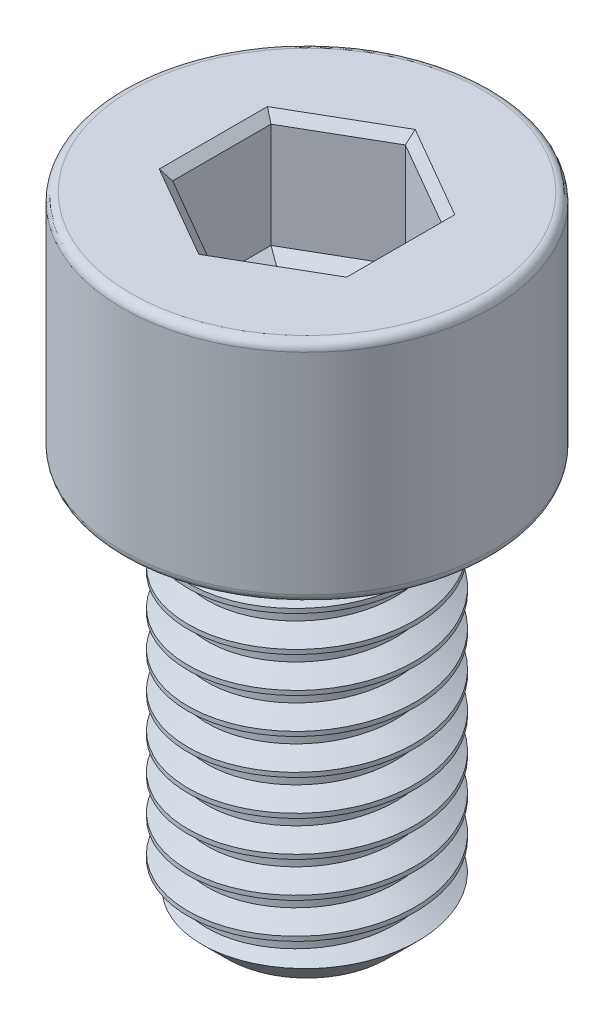
from build123d import *

# Parameters (mm, degrees)
SKETCH1_R           = 4
BOSS_EXTRUDE1_DEPTH = 14
THREAD1_PITCH       = 1.25
SKETCH2_R           = 6.5
BOSS_EXTRUDE2_DEPTH = 8
FILLET1_R           = 0.3
CUT_EXTRUDE1_DEPTH  = 4
CHAMFER1_SIZE       = 0.3
CUT_EXTRUDE2_DEPTH  = 0.4
CUT_EXTRUDE2_DRAFT  = -60


with BuildPart() as part:
    # Sketch1 → Boss-Extrude1 (new body)
    with BuildSketch(Plane(origin=(0, 0, 0), x_dir=(1, 0, 0), z_dir=(0, 1, 0))):
        with Locations(Location((0, 0, 0), (0, 0, 270))):
            Circle(SKETCH1_R)
    extrude(amount=BOSS_EXTRUDE1_DEPTH)

    # Thread1: the profile of Thread Profile1 profile screwed along a right-hand helix of 12.2 turns, 8 arcs to a turn; built about Z, then put on its axis
    thread1_z = Axis((0, 0, 0), (0, 0, 1))
    thread1_corners = [(4.0003, 0, -0.000173205), (4.0003, 0, 1.093923202), (3.323417656, 0, 0.703124998), (3.323417656, 0, 0.390624998)]
    with BuildLine(mode=Mode.PRIVATE) as thread1_profile:
        Line(thread1_corners[0], thread1_corners[1])
        Line(thread1_corners[1], thread1_corners[2])
        Line(thread1_corners[2], thread1_corners[3])
        Line(thread1_corners[3], thread1_corners[0])
    thread1_cap = Face(thread1_profile.wire())
    thread1_turn_angles = [0, 22.5, 45, 67.5, 90, 112.5, 135, 157.5, 180, 202.5, 225, 247.5, 270, 292.5, 315, 337.5, 360]
    thread1_turn_weights = [1, 0.9238795325112867, 1, 0.9238795325112867, 1, 0.9238795325112867, 1, 0.9238795325112867, 1, 0.9238795325112867, 1, 0.9238795325112867, 1, 0.9238795325112867, 1, 0.9238795325112867, 1]
    thread1_turn_rails = [Edge.make_bspline([Vector(p[0], p[1], 0).rotate(thread1_z, thread1_turn_angles[k]) / thread1_turn_weights[k] + Vector(0, 0, p[2] + THREAD1_PITCH * thread1_turn_angles[k] / 360) for k in range(17)], [0, 0, 0, 1, 1, 2, 2, 3, 3, 4, 4, 5, 5, 6, 6, 7, 7, 8, 8, 8], 2, thread1_turn_weights) for p in thread1_corners]
    thread1_turn_sides = [Face.make_surface_from_curves(thread1_turn_rails[p[0]], thread1_turn_rails[p[1]]) for p in [(0, 1), (1, 2), (2, 3), (3, 0)]]
    thread1_last_angles = [4320, 4342.5, 4365, 4378.5, 4392]
    thread1_last_weights = [1, 0.9238795325112867, 1, 0.9723699203976766, 1]
    thread1_last_rails = [Edge.make_bspline([Vector(p[0], p[1], 0).rotate(thread1_z, thread1_last_angles[k]) / thread1_last_weights[k] + Vector(0, 0, p[2] + THREAD1_PITCH * thread1_last_angles[k] / 360) for k in range(5)], [0, 0, 0, 1, 1, 2, 2, 2], 2, thread1_last_weights) for p in thread1_corners]
    thread1_last_sides = [Face.make_surface_from_curves(thread1_last_rails[p[0]], thread1_last_rails[p[1]]) for p in [(0, 1), (1, 2), (2, 3), (3, 0)]]
    thread1 = Plane(origin=(0, 15.25, 0), x_dir=(-1, 0, 0), z_dir=(0, -1, 0)) * Solid(Shell([*[p.moved(Location((0, 0, THREAD1_PITCH * i))) for i in range(12) for p in thread1_turn_sides], *thread1_last_sides, thread1_cap, thread1_cap.rotate(thread1_z, 4392).moved(Location((0, 0, THREAD1_PITCH * 4392 / 360)))]))
    add(thread1, mode=Mode.SUBTRACT)

    # Sketch2 → Boss-Extrude2 (add)
    with BuildSketch(Plane(origin=(0, 14, 0), x_dir=(1, 0, 0), z_dir=(0, 1, 0))):
        with Locations(Location((0, 0, 0), (0, 0, 270))):
            Circle(SKETCH2_R)
    extrude(amount=BOSS_EXTRUDE2_DEPTH)

    # Sketch5 → Cut-Revolve1 (revolve, cut)
    with BuildSketch(Plane.XY, mode=Mode.PRIVATE) as cut_revolve1_sk:
        Polygon((4.01, 0), (4.01, 1.2), (2.81, 0), align=None)
    revolve(cut_revolve1_sk.sketch.rotate(Axis((0, 0, 0), (0, 1, 0)), 8.588527592), axis=Axis((0, 0, 0), (0, 1, 0)), mode=Mode.SUBTRACT)

    # Fillet1
    fillet1_edges = [part.edges().sort_by_distance(p)[0] for p in [
        (0, 14, -6.5),
        (0, 22, -6.5),
    ]]
    fillet(fillet1_edges, radius=FILLET1_R)

    # Sketch6 → Cut-Extrude1 (cut)
    with BuildSketch(Plane(origin=(0, 22, 0), x_dir=(1, 0, 0), z_dir=(0, 1, 0))):
        Polygon((0, 3.464101615), (-3, 1.732050808), (-3, -1.732050808), (0, -3.464101615), (3, -1.732050808), (3, 1.732050808), align=None)
    extrude(amount=-CUT_EXTRUDE1_DEPTH, mode=Mode.SUBTRACT)

    # Chamfer1
    chamfer1_edges = [part.edges().sort_by_distance(p)[0] for p in [
        (1.5, 22, -2.598076211),
        (-1.5, 22, -2.598076211),
        (-3, 22, 0),
        (-1.5, 22, 2.598076211),
        (1.5, 22, 2.598076211),
        (3, 22, 0),
    ]]
    chamfer(chamfer1_edges, length=CHAMFER1_SIZE)


with BuildPart() as cut_extrude2_tool:
    # Sketch7 → Cut-Extrude2 (with draft: the straight prism first)
    with BuildSketch(Plane(origin=(0, 18, 0), x_dir=(1, 0, 0), z_dir=(0, 1, 0))):
        Polygon((0, 3.464101615), (-3, 1.732050808), (-3, -1.732050808), (0, -3.464101615), (3, -1.732050808), (3, 1.732050808), align=None)
    extrude(amount=-CUT_EXTRUDE2_DEPTH)
    # Cut-Extrude2: the draft: its side faces are tilted about the plane it starts from
    cut_extrude2_sides = [cut_extrude2_tool.faces().sort_by_distance(p)[0] for p in [
        (-1.5, 17.8, -2.598076211),
        (-3, 17.8, 0),
        (-1.5, 17.8, 2.598076211),
        (1.5, 17.8, 2.598076211),
        (3, 17.8, 0),
        (1.5, 17.8, -2.598076211),
    ]]
    draft(cut_extrude2_sides, Plane(origin=(0, 18, 0), x_dir=(1, 0, 0), z_dir=(0, 1, 0)), CUT_EXTRUDE2_DRAFT)


with BuildPart() as part_1:
    add(part.part)

    # Cut-Extrude2: cut by cut_extrude2_tool
    add(cut_extrude2_tool.part, mode=Mode.SUBTRACT)


solid = part_1.part
